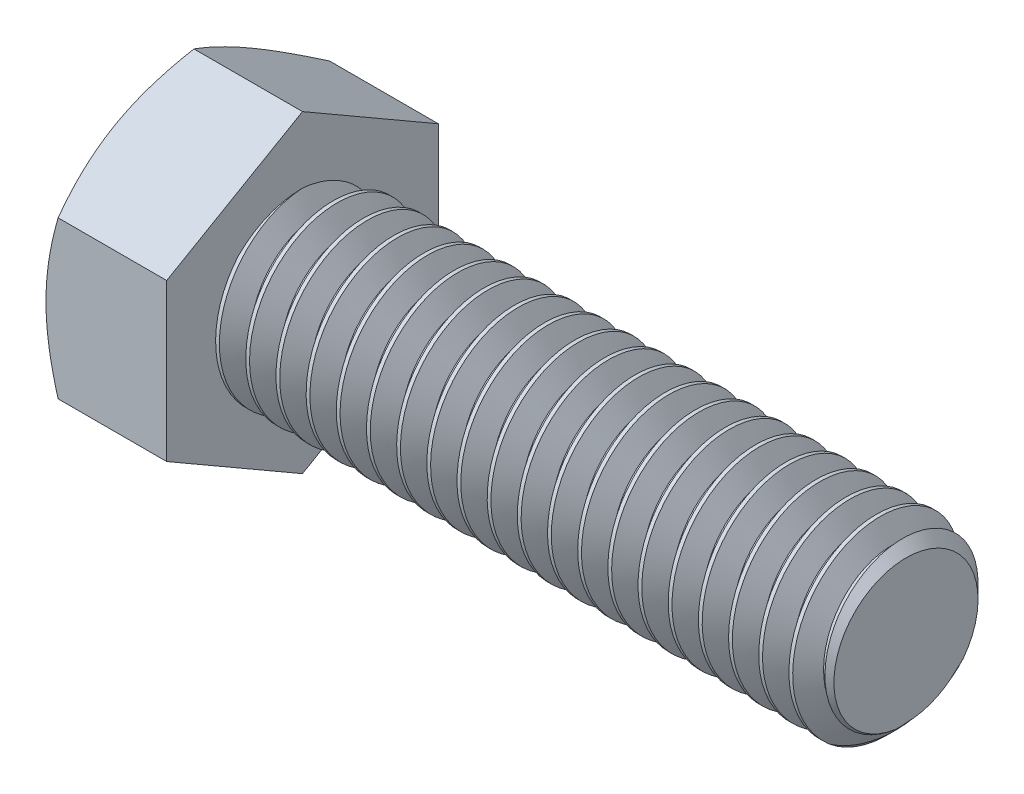
from build123d import *

# Parameters (mm, degrees)
SKETCH5_R           = 4.7625
BOSS_EXTRUDE3_DEPTH = 31.75
CHAMFER1_SIZE       = 0.97155
CUT_SWEEP1_PITCH    = 1.5875
BOSS_EXTRUDE4_DEPTH = 6.35
SKETCH8_OUTSIDE_W   = 165.822
SKETCH8_OUTSIDE_H   = 168.032
SKETCH8_OUTSIDE_R   = 7.14375
CUT_EXTRUDE3_DEPTH  = 40.631898687
CUT_EXTRUDE3_DRAFT  = -60
CUT_EXTRUDE4_DEPTH  = 0.254
CIRPATTERN1_COUNT   = 3


with BuildPart() as part:
    # Sketch5 → Boss-Extrude3 (new body)
    with BuildSketch(Plane(origin=(19.05, 0, 0), x_dir=(0, 0, -1), z_dir=(1, 0, 0))):
        Circle(SKETCH5_R)
    extrude(amount=-BOSS_EXTRUDE3_DEPTH)

    # Chamfer1
    chamfer1_edges = [part.edges().sort_by_distance(p)[0] for p in [
        (19.05, 0, 4.7625),
    ]]
    chamfer(chamfer1_edges, length=CHAMFER1_SIZE)

    # Cut-Sweep1: the profile of Sketch10 profile screwed along a right-hand helix of 21 turns, 8 arcs to a turn; built about Z, then put on its axis
    cut_sweep1_z = Axis((0, 0, 0), (0, 0, 1))
    cut_sweep1_corners = [(4.7628, 0, 0.000173205), (3.731388504, 0, -0.5953125), (3.731388504, 0, -0.79375), (4.7628, 0, -1.389235705)]
    with BuildLine(mode=Mode.PRIVATE) as cut_sweep1_profile:
        Line(cut_sweep1_corners[0], cut_sweep1_corners[1])
        Line(cut_sweep1_corners[1], cut_sweep1_corners[2])
        Line(cut_sweep1_corners[2], cut_sweep1_corners[3])
        Line(cut_sweep1_corners[3], cut_sweep1_corners[0])
    cut_sweep1_cap = Face(cut_sweep1_profile.wire())
    cut_sweep1_turn_angles = [0, 22.5, 45, 67.5, 90, 112.5, 135, 157.5, 180, 202.5, 225, 247.5, 270, 292.5, 315, 337.5, 360]
    cut_sweep1_turn_weights = [1, 0.9238795325112867, 1, 0.9238795325112867, 1, 0.9238795325112867, 1, 0.9238795325112867, 1, 0.9238795325112867, 1, 0.9238795325112867, 1, 0.9238795325112867, 1, 0.9238795325112867, 1]
    cut_sweep1_turn_rails = [Edge.make_bspline([Vector(p[0], p[1], 0).rotate(cut_sweep1_z, cut_sweep1_turn_angles[k]) / cut_sweep1_turn_weights[k] + Vector(0, 0, p[2] + CUT_SWEEP1_PITCH * cut_sweep1_turn_angles[k] / 360) for k in range(17)], [0, 0, 0, 1, 1, 2, 2, 3, 3, 4, 4, 5, 5, 6, 6, 7, 7, 8, 8, 8], 2, cut_sweep1_turn_weights) for p in cut_sweep1_corners]
    cut_sweep1_turn_sides = [Face.make_surface_from_curves(cut_sweep1_turn_rails[p[0]], cut_sweep1_turn_rails[p[1]]) for p in [(0, 1), (1, 2), (2, 3), (3, 0)]]
    cut_sweep1 = Plane(origin=(19.05, 0, 0), x_dir=(0, 1, 0), z_dir=(-1, 0, 0)) * Solid(Shell([*[p.moved(Location((0, 0, CUT_SWEEP1_PITCH * i))) for i in range(21) for p in cut_sweep1_turn_sides], cut_sweep1_cap, cut_sweep1_cap.rotate(cut_sweep1_z, 7560).moved(Location((0, 0, CUT_SWEEP1_PITCH * 7560 / 360)))]))
    add(cut_sweep1, mode=Mode.SUBTRACT)

    # Sketch6 → Boss-Extrude4 (add)
    with BuildSketch(Plane.ZY.offset(12.7)):
        Polygon((7.14375, 4.124445986), (0, 8.248891971), (-7.14375, 4.124445986), (-7.14375, -4.124445986), (0, -8.248891971), (7.14375, -4.124445986), align=None)
    extrude(amount=BOSS_EXTRUDE4_DEPTH)


with BuildPart() as cut_extrude3_tool:
    # Sketch8 outside → Cut-Extrude3 (with draft: the straight prism first)
    with BuildSketch(Plane.ZY.offset(19.05)):
        Rectangle(SKETCH8_OUTSIDE_W, SKETCH8_OUTSIDE_H)
        Circle(SKETCH8_OUTSIDE_R, mode=Mode.SUBTRACT)
    extrude(amount=-CUT_EXTRUDE3_DEPTH)
    # Cut-Extrude3: the draft: its side faces are tilted about the plane it starts from
    cut_extrude3_sides = [cut_extrude3_tool.faces().sort_by_distance(p)[0] for p in [
        (1.265949343, -84.016, 0),
        (1.265949343, 0, 82.911),
        (1.265949343, 84.016, 0),
        (1.265949343, 0, -82.911),
        (1.265949343, 0, -7.14375),
    ]]
    draft(cut_extrude3_sides, Plane.ZY.offset(19.05), CUT_EXTRUDE3_DRAFT)


with BuildPart() as part_1:
    add(part.part)

    # Cut-Extrude3: cut by cut_extrude3_tool
    add(cut_extrude3_tool.part, mode=Mode.SUBTRACT)

    # Sketch12 → Cut-Extrude4 (cut)
    with BuildSketch(Plane.ZY.offset(19.05)):
        with BuildLine():
            Line((0.2143125, 5.5006875), (0.2143125, 3.0718125))
            ThreePointArc((0.2143125, 3.0718125), (0, 2.8575), (-0.2143125, 3.0718125))
            Line((-0.2143125, 3.0718125), (-0.2143125, 5.5006875))
            ThreePointArc((-0.2143125, 5.5006875), (0, 5.715), (0.2143125, 5.5006875))
        make_face()
    cut_extrude4 = extrude(amount=-CUT_EXTRUDE4_DEPTH, mode=Mode.SUBTRACT)

    # CirPattern1: Cut-Extrude4 ×3 about axis
    cirpattern1_axis = Axis((0, 0, 0), (1, 0, 0))
    for i in range(1, CIRPATTERN1_COUNT):
        add(cut_extrude4.rotate(cirpattern1_axis, i * 360 / CIRPATTERN1_COUNT), mode=Mode.SUBTRACT)


solid = part_1.part
